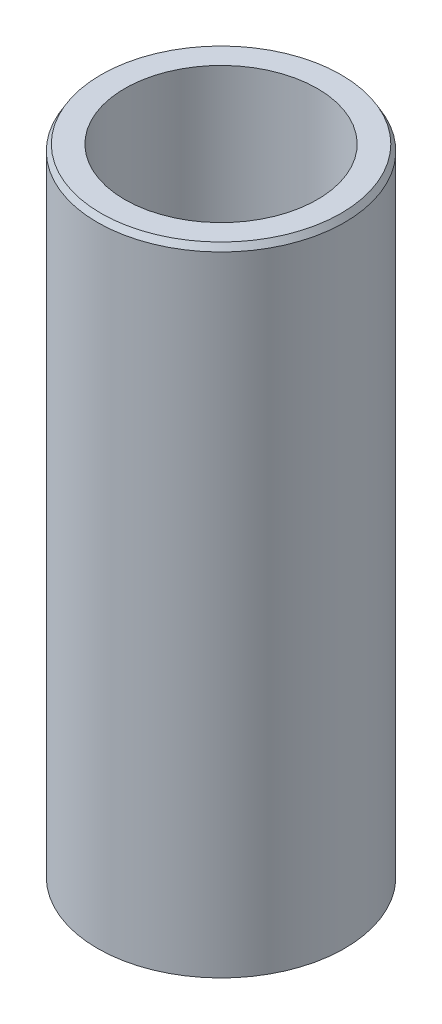
from build123d import *
from OCP.BRepFilletAPI import BRepFilletAPI_MakeChamfer

# Parameters (mm, degrees)
SKETCH1_R           = 52.5
BOSS_EXTRUDE1_DEPTH = 271.175712515
SKETCH2_R           = 40.897052147
CUT_EXTRUDE1_DEPTH  = 282.15612577
CHAMFER1_SIZE       = 2.603757864
CHAMFER1_SIZE2      = 1.503280304


with BuildPart() as part:
    # Sketch1 → Boss-Extrude1 (new body)
    with BuildSketch(Plane(origin=(0, 0, 0), x_dir=(1, 0, 0), z_dir=(0, 1, 0))):
        Circle(SKETCH1_R)
    extrude(amount=BOSS_EXTRUDE1_DEPTH)

    # Sketch2 → Cut-Extrude1 (cut, through all)
    with BuildSketch(Plane(origin=(0, 0, 0), x_dir=(1, 0, 0), z_dir=(0, 1, 0))):
        Circle(SKETCH2_R)
    extrude(amount=CUT_EXTRUDE1_DEPTH, mode=Mode.SUBTRACT)

    # Chamfer1: one chamfer whose edges measure the first distance from different faces: ONE call of the kernel's chamfer builder (chamfer() names one face for all edges)
    chamfer1_edges_1 = [part.edges().sort_by_distance(p)[0] for p in [
        (-52.5, 271.175712515, 0),
    ]]
    chamfer1_side_1 = [part.faces().sort_by_distance(p)[0] for p in [
        (-52.5, 135.587856258, 0),
    ]]
    chamfer1_edges_2 = [part.edges().sort_by_distance(p)[0] for p in [
        (-52.5, 0, 0),
    ]]
    chamfer1_side_2 = [part.faces().sort_by_distance(p)[0] for p in [
        (-51.01507576, 0, 0),
    ]]
    chamfer1 = BRepFilletAPI_MakeChamfer(part.part.solid().wrapped)
    for e in chamfer1_edges_1:
        chamfer1.Add(CHAMFER1_SIZE, CHAMFER1_SIZE2, e.wrapped, chamfer1_side_1[0].wrapped)  # the first distance lies on this face
    for e in chamfer1_edges_2:
        chamfer1.Add(CHAMFER1_SIZE, CHAMFER1_SIZE2, e.wrapped, chamfer1_side_2[0].wrapped)  # the first distance lies on this face
    add(Compound.cast(chamfer1.Shape()), mode=Mode.REPLACE)


solid = part.part
